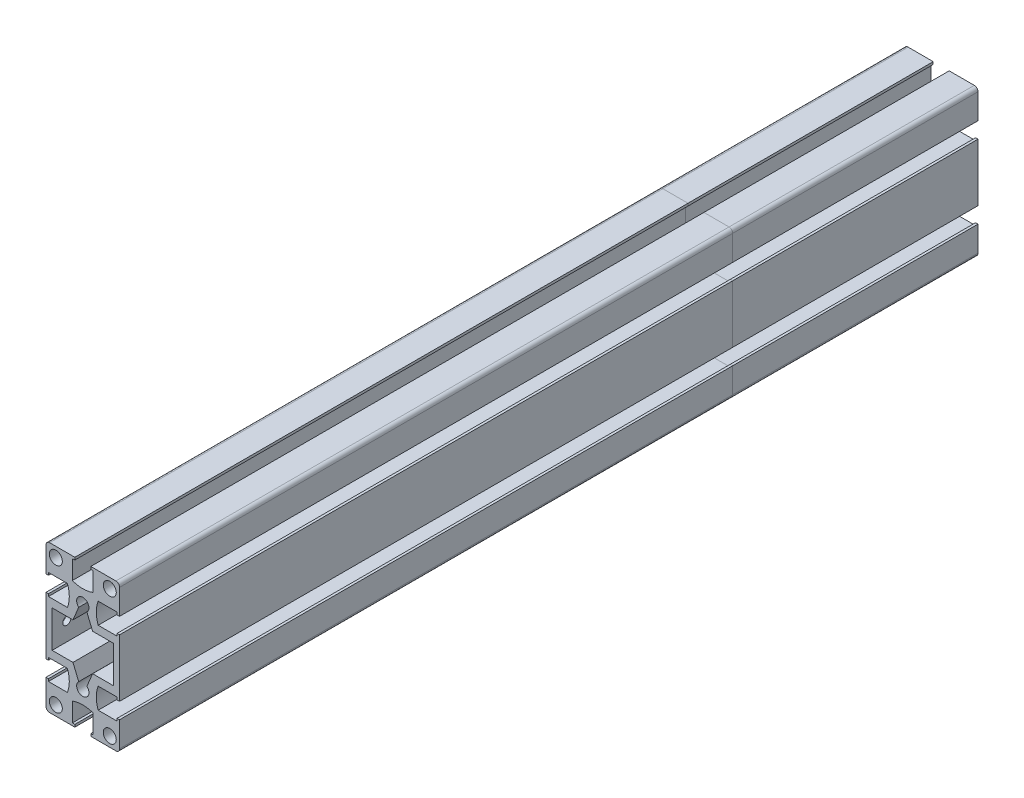
from build123d import *

# Parameters (mm, degrees)
SKETCH1_2_R                  = 2.65
EXTRUDE_1_DEPTH              = 250
HOLE_WIZARD_M4_1_D           = 3.3
HOLE_WIZARD_M4_1_DEPTH       = 2.5
HOLE_WIZARD_M4_1_CSINK_D     = 4.05
HOLE_WIZARD_M4_1_CSINK_ANGLE = 90
SKETCH1_3_R                  = 2.65
EXTRUDE_2_DEPTH              = 100
HOLE_WIZARD_M4_2_AT_2_COUNT  = 2
HOLE_WIZARD_M4_2_AT_2_PITCH  = 180
HOLE_WIZARD_M4_3_AT_2_COUNT  = 2
HOLE_WIZARD_M4_3_AT_2_PITCH  = 24


# Read off the part's stored shape, not the designer's step: 30 x 60G x R1.5<1>
with BuildPart() as part:
    # Sketch1<2> → 凸台-拉伸1 (new body)
    with BuildSketch(Plane(origin=(1.902137601, -4.901792835, 0), x_dir=(1, 0, 0), z_dir=(0, 0, 1))):
        with BuildLine():
            Line((-3.25, 30), (-3.25, 29))
            Line((-3.25, 29), (-4.25, 29))
            Line((-4.25, 29), (-4.25, 21.277812156))
            ThreePointArc((-4.25, 21.277812156), (0, 20.5), (4.25, 21.277812156))
            Line((4.25, 21.277812156), (4.25, 29))
            Line((4.25, 29), (3.25, 29))
            Line((3.25, 29), (3.25, 30))
            Line((3.25, 30), (13.5, 30))
            ThreePointArc((13.5, 30), (14.560660172, 29.560660172), (15, 28.5))
            Line((15, 28.5), (15, 18.25))
            Line((15, 18.25), (14, 18.25))
            Line((14, 18.25), (14, 19.25))
            Line((14, 19.25), (6.277812156, 19.25))
            ThreePointArc((6.277812156, 19.25), (5.5, 15), (6.277812156, 10.75))
            Line((6.277812156, 10.75), (14, 10.75))
            Line((14, 10.75), (14, 11.75))
            Line((14, 11.75), (15, 11.75))
            Line((15, 11.75), (15, -11.75))
            Line((15, -11.75), (14, -11.75))
            Line((14, -11.75), (14, -10.75))
            Line((14, -10.75), (6.277812156, -10.75))
            ThreePointArc((6.277812156, -10.75), (5.5, -15), (6.277812156, -19.25))
            Line((6.277812156, -19.25), (14, -19.25))
            Line((14, -19.25), (14, -18.25))
            Line((14, -18.25), (15, -18.25))
            Line((15, -18.25), (15, -28.5))
            ThreePointArc((15, -28.5), (14.560660172, -29.560660172), (13.5, -30))
            Line((13.5, -30), (3.25, -30))
            Line((3.25, -30), (3.25, -29))
            Line((3.25, -29), (4.25, -29))
            Line((4.25, -29), (4.25, -21.277812156))
            ThreePointArc((4.25, -21.277812156), (0, -20.5), (-4.25, -21.277812156))
            Line((-4.25, -21.277812156), (-4.25, -29))
            Line((-4.25, -29), (-3.25, -29))
            Line((-3.25, -29), (-3.25, -30))
            Line((-3.25, -30), (-13.5, -30))
            ThreePointArc((-13.5, -30), (-14.560660172, -29.560660172), (-15, -28.5))
            Line((-15, -28.5), (-15, -18.25))
            Line((-15, -18.25), (-14, -18.25))
            Line((-14, -18.25), (-14, -19.25))
            Line((-14, -19.25), (-6.277812156, -19.25))
            ThreePointArc((-6.277812156, -19.25), (-5.5, -15), (-6.277812156, -10.75))
            Line((-6.277812156, -10.75), (-14, -10.75))
            Line((-14, -10.75), (-14, -11.75))
            Line((-14, -11.75), (-15, -11.75))
            Line((-15, -11.75), (-15, 11.75))
            Line((-15, 11.75), (-14, 11.75))
            Line((-14, 11.75), (-14, 10.75))
            Line((-14, 10.75), (-6.277812156, 10.75))
            ThreePointArc((-6.277812156, 10.75), (-5.5, 15), (-6.277812156, 19.25))
            Line((-6.277812156, 19.25), (-14, 19.25))
            Line((-14, 19.25), (-14, 18.25))
            Line((-14, 18.25), (-15, 18.25))
            Line((-15, 18.25), (-15, 28.5))
            ThreePointArc((-15, 28.5), (-14.560660172, 29.560660172), (-13.5, 30))
            Line((-13.5, 30), (-3.25, 30))
        make_face()
        with Locations((-11, 26)):
            Circle(SKETCH1_2_R, mode=Mode.SUBTRACT)
        with Locations(Location((11, 26, 0), (0, 0, 180))):
            Circle(SKETCH1_2_R, mode=Mode.SUBTRACT)
        with Locations((11, -26)):
            Circle(SKETCH1_2_R, mode=Mode.SUBTRACT)
        with Locations(Location((-11, -26, 0), (0, 0, 180))):
            Circle(SKETCH1_2_R, mode=Mode.SUBTRACT)
        with BuildLine():
            Line((-12.5, 7.5), (-4, 7.5))
            Line((-4, 7.5), (-1.665625283, 13.135679101))
            ThreePointArc((-1.665625283, 13.135679101), (0, 17.5), (1.665625283, 13.135679101))
            Line((1.665625283, 13.135679101), (4, 7.5))
            Line((4, 7.5), (12.5, 7.5))
            Line((12.5, 7.5), (12.5, -7.5))
            Line((12.5, -7.5), (4, -7.5))
            Line((4, -7.5), (1.665625283, -13.135679101))
            ThreePointArc((1.665625283, -13.135679101), (0, -17.5), (-1.665625283, -13.135679101))
            Line((-1.665625283, -13.135679101), (-4, -7.5))
            Line((-4, -7.5), (-12.5, -7.5))
            Line((-12.5, -7.5), (-12.5, 7.5))
        make_face(mode=Mode.SUBTRACT)
    extrude(amount=EXTRUDE_1_DEPTH)

    # M4 螺纹孔1
    with Locations(Plane.ZY.offset(13.097862399)):
        with Locations((244, -4.901792835)):
            CounterSinkHole(HOLE_WIZARD_M4_1_D / 2, HOLE_WIZARD_M4_1_CSINK_D / 2, depth=HOLE_WIZARD_M4_1_DEPTH, counter_sink_angle=HOLE_WIZARD_M4_1_CSINK_ANGLE)

    # 草图8 → M4 螺纹孔2 (revolve, cut)
    with BuildSketch(Plane(origin=(-13.097862399, -4.901792835, 210), x_dir=(0, 0, 1), z_dir=(0, 1, 0))):
        Polygon((0, 0), (0, 2.5), (1.65, 2.5), (1.65, 0.375), (2.025, 0), align=None)
    hole_wizard_m4_2 = revolve(axis=Axis((-19.447862399, -4.901792835, 210), (1, 0, 0)), mode=Mode.SUBTRACT)

    # M4 螺纹孔2 at 2: M4 螺纹孔2 ×2
    with Locations(*[(0, 0, -i * HOLE_WIZARD_M4_2_AT_2_PITCH) for i in range(1, HOLE_WIZARD_M4_2_AT_2_COUNT)]):
        add(hole_wizard_m4_2, mode=Mode.SUBTRACT)


with BuildPart() as body_2:
    # Sketch1<3> → 凸台-拉伸2 (new body)
    with BuildSketch(Plane(origin=(1.902137601, -4.901792835, 0), x_dir=(1, 0, 0), z_dir=(0, 0, 1))):
        with BuildLine():
            Line((-3.25, 30), (-3.25, 29))
            Line((-3.25, 29), (-4.25, 29))
            Line((-4.25, 29), (-4.25, 21.277812156))
            ThreePointArc((-4.25, 21.277812156), (0, 20.5), (4.25, 21.277812156))
            Line((4.25, 21.277812156), (4.25, 29))
            Line((4.25, 29), (3.25, 29))
            Line((3.25, 29), (3.25, 30))
            Line((3.25, 30), (13.5, 30))
            ThreePointArc((13.5, 30), (14.560660172, 29.560660172), (15, 28.5))
            Line((15, 28.5), (15, 18.25))
            Line((15, 18.25), (14, 18.25))
            Line((14, 18.25), (14, 19.25))
            Line((14, 19.25), (6.277812156, 19.25))
            ThreePointArc((6.277812156, 19.25), (5.5, 15), (6.277812156, 10.75))
            Line((6.277812156, 10.75), (14, 10.75))
            Line((14, 10.75), (14, 11.75))
            Line((14, 11.75), (15, 11.75))
            Line((15, 11.75), (15, -11.75))
            Line((15, -11.75), (14, -11.75))
            Line((14, -11.75), (14, -10.75))
            Line((14, -10.75), (6.277812156, -10.75))
            ThreePointArc((6.277812156, -10.75), (5.5, -15), (6.277812156, -19.25))
            Line((6.277812156, -19.25), (14, -19.25))
            Line((14, -19.25), (14, -18.25))
            Line((14, -18.25), (15, -18.25))
            Line((15, -18.25), (15, -28.5))
            ThreePointArc((15, -28.5), (14.560660172, -29.560660172), (13.5, -30))
            Line((13.5, -30), (3.25, -30))
            Line((3.25, -30), (3.25, -29))
            Line((3.25, -29), (4.25, -29))
            Line((4.25, -29), (4.25, -21.277812156))
            ThreePointArc((4.25, -21.277812156), (0, -20.5), (-4.25, -21.277812156))
            Line((-4.25, -21.277812156), (-4.25, -29))
            Line((-4.25, -29), (-3.25, -29))
            Line((-3.25, -29), (-3.25, -30))
            Line((-3.25, -30), (-13.5, -30))
            ThreePointArc((-13.5, -30), (-14.560660172, -29.560660172), (-15, -28.5))
            Line((-15, -28.5), (-15, -18.25))
            Line((-15, -18.25), (-14, -18.25))
            Line((-14, -18.25), (-14, -19.25))
            Line((-14, -19.25), (-6.277812156, -19.25))
            ThreePointArc((-6.277812156, -19.25), (-5.5, -15), (-6.277812156, -10.75))
            Line((-6.277812156, -10.75), (-14, -10.75))
            Line((-14, -10.75), (-14, -11.75))
            Line((-14, -11.75), (-15, -11.75))
            Line((-15, -11.75), (-15, 11.75))
            Line((-15, 11.75), (-14, 11.75))
            Line((-14, 11.75), (-14, 10.75))
            Line((-14, 10.75), (-6.277812156, 10.75))
            ThreePointArc((-6.277812156, 10.75), (-5.5, 15), (-6.277812156, 19.25))
            Line((-6.277812156, 19.25), (-14, 19.25))
            Line((-14, 19.25), (-14, 18.25))
            Line((-14, 18.25), (-15, 18.25))
            Line((-15, 18.25), (-15, 28.5))
            ThreePointArc((-15, 28.5), (-14.560660172, 29.560660172), (-13.5, 30))
            Line((-13.5, 30), (-3.25, 30))
        make_face()
        with Locations((-11, 26)):
            Circle(SKETCH1_3_R, mode=Mode.SUBTRACT)
        with Locations((11, 26)):
            Circle(SKETCH1_3_R, mode=Mode.SUBTRACT)
        with Locations((11, -26)):
            Circle(SKETCH1_3_R, mode=Mode.SUBTRACT)
        with Locations((-11, -26)):
            Circle(SKETCH1_3_R, mode=Mode.SUBTRACT)
        with BuildLine():
            Line((-12.5, 7.5), (-4, 7.5))
            Line((-4, 7.5), (-1.665625283, 13.135679101))
            ThreePointArc((-1.665625283, 13.135679101), (0, 17.5), (1.665625283, 13.135679101))
            Line((1.665625283, 13.135679101), (4, 7.5))
            Line((4, 7.5), (12.5, 7.5))
            Line((12.5, 7.5), (12.5, -7.5))
            Line((12.5, -7.5), (4, -7.5))
            Line((4, -7.5), (1.665625283, -13.135679101))
            ThreePointArc((1.665625283, -13.135679101), (0, -17.5), (-1.665625283, -13.135679101))
            Line((-1.665625283, -13.135679101), (-4, -7.5))
            Line((-4, -7.5), (-12.5, -7.5))
            Line((-12.5, -7.5), (-12.5, 7.5))
        make_face(mode=Mode.SUBTRACT)
    extrude(amount=-EXTRUDE_2_DEPTH)

    # 草图11 → M4 螺纹孔3 (revolve, cut)
    with BuildSketch(Plane(origin=(-13.097862399, -4.901792835, -21), x_dir=(0, 0, 1), z_dir=(0, 1, 0))):
        Polygon((0, 0), (0, 2.5), (1.65, 2.5), (1.65, 0.375), (2.025, 0), align=None)
    hole_wizard_m4_3 = revolve(axis=Axis((-19.447862399, -4.901792835, -21), (1, 0, 0)), mode=Mode.SUBTRACT)

    # M4 螺纹孔3 at 2: M4 螺纹孔3 ×2
    with Locations(*[(0, 0, -i * HOLE_WIZARD_M4_3_AT_2_PITCH) for i in range(1, HOLE_WIZARD_M4_3_AT_2_COUNT)]):
        add(hole_wizard_m4_3, mode=Mode.SUBTRACT)


solid = Compound([part.part, body_2.part])
